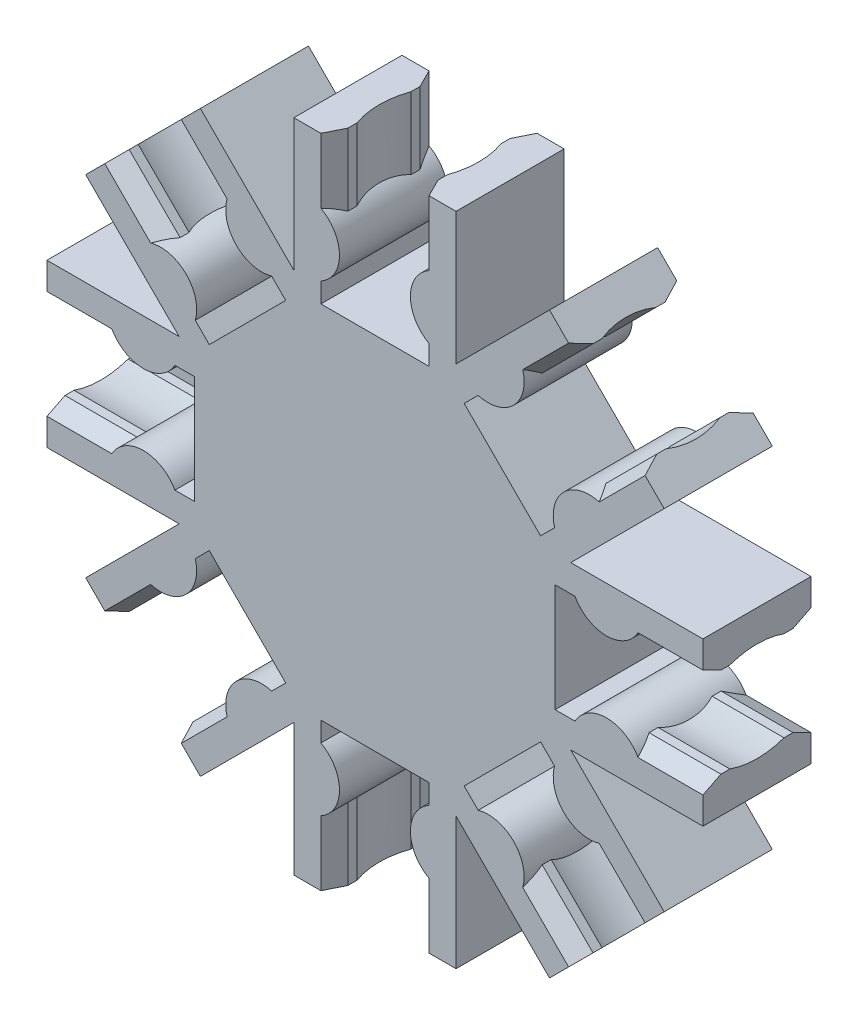
from build123d import *

# Parameters (mm, degrees)
EXTRUDE_1_DEPTH          = 6
EXTRUDE_2_REACH          = 25.907
PATTERN_CIRCULAR_1_COUNT = 8


with BuildPart() as part:
    # 草图1 → 凸台-拉伸1 (new body)
    with BuildSketch(Plane.XY):
        with BuildLine():
            Line((-4.5, 0), (-4.5, -18.2))
            Line((-4.5, -18.2), (-3, -18.2))
            Line((-3, -18.2), (-3, -14.6))
            ThreePointArc((-3, -14.6), (-1.968245837, -12.85), (-3, -11.1))
            Line((-3, -11.1), (-3, -10))
            Line((-3, -10), (3, -10))
            Line((3, -10), (3, -11.1))
            ThreePointArc((3, -11.1), (1.968245837, -12.85), (3, -14.6))
            Line((3, -14.6), (3, -18.2))
            Line((3, -18.2), (4.5, -18.2))
            Line((4.5, -18.2), (4.5, 0))
            ThreePointArc((4.5, 0), (0, 4.5), (-4.5, 0))
        make_face()
    extrude_1 = extrude(amount=EXTRUDE_1_DEPTH)

    # 草图3 → 凸台-拉伸2 (add, up to next)
    with BuildSketch(Plane.XZ.offset(18.2), mode=Mode.PRIVATE) as extrude_2_sk1:
        with BuildLine():
            Line((-3, 6), (-3, 0))
            Line((-3, 0), (-2.5, 1))
            Line((-2.5, 1), (-2.5, 1.5))
            ThreePointArc((-2.5, 1.5), (-2.757359313, 3), (-2.5, 4.5))
            Line((-2.5, 4.5), (-2.5, 5))
            Line((-2.5, 5), (-3, 6))
        make_face()
    extrude_2_tool1 = extrude(extrude_2_sk1.sketch, amount=-EXTRUDE_2_REACH, mode=Mode.PRIVATE) - part.part
    # 草图3 → 凸台-拉伸2 (add, up to next)
    with BuildSketch(Plane.XZ.offset(18.2), mode=Mode.PRIVATE) as extrude_2_sk2:
        with BuildLine():
            Line((3, 0), (2.5, 1))
            Line((2.5, 1), (2.5, 1.5))
            ThreePointArc((2.5, 1.5), (2.757359313, 3), (2.5, 4.5))
            Line((2.5, 4.5), (2.5, 5))
            Line((2.5, 5), (3, 6))
            Line((3, 6), (3, 0))
        make_face()
    extrude_2_tool2 = extrude(extrude_2_sk2.sketch, amount=-EXTRUDE_2_REACH, mode=Mode.PRIVATE) - part.part
    extrude_2_1 = extrude_2_tool1.solids().sort_by_distance((-2.809362, -18.2, 3))[0]
    add(extrude_2_1)
    extrude_2_2 = extrude_2_tool2.solids().sort_by_distance((2.809362, -18.2, 3))[0]
    add(extrude_2_2)
    extrude_2 = extrude_2_1 + extrude_2_2  # 凸台-拉伸2 as one shape, for the pattern or mirror that repeats it

    # 阵列(圆周)1: 凸台-拉伸1, 凸台-拉伸2 ×8 about axis
    pattern_circular_1_axis = Axis((0, 0, 0), (0, 0, 1))
    add([extrude_1.rotate(pattern_circular_1_axis, i * 360 / PATTERN_CIRCULAR_1_COUNT) for i in range(1, PATTERN_CIRCULAR_1_COUNT)])
    add([extrude_2.rotate(pattern_circular_1_axis, i * 360 / PATTERN_CIRCULAR_1_COUNT) for i in range(1, PATTERN_CIRCULAR_1_COUNT)])


solid = part.part
